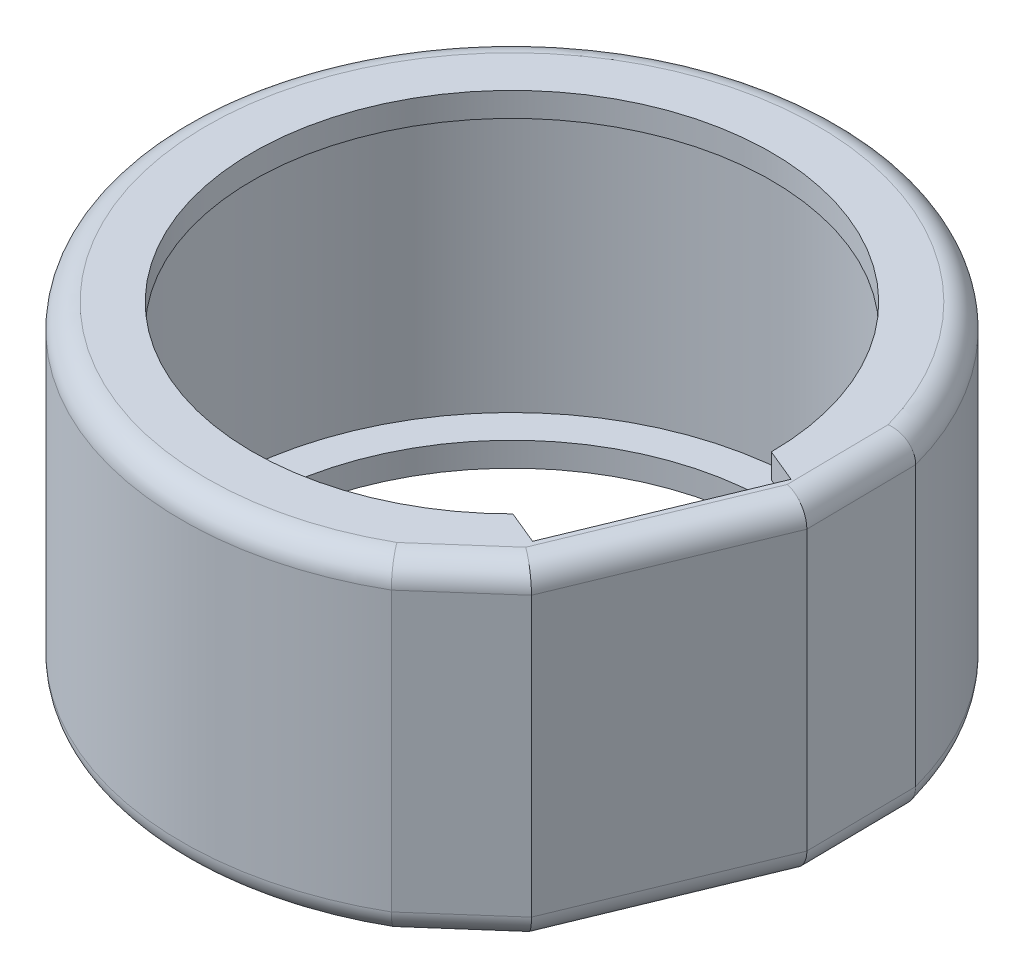
from build123d import *

# Parameters (mm, degrees)
EXTRUDE_1_DEPTH         = 1
EXTRUDE_START           = 11.5
EXTRUDE_3_DEPTH         = 11.5
EXTRUDE_START_2         = 1
EXTRUDE_4_DEPTH         = 1
FILLET_1_R              = 1
FILLET_2_R              = 1
SKETCH_7_W              = 8.165789474
SKETCH_7_H              = 1
CUT_EXTRUDE_1_DEPTH     = 1.5
CUT_EXTRUDE1_REACH      = 35.09
CUT_EXTRUDE1_END_RADIUS = 12.1
SKETCH5_R               = 0.8


with BuildPart() as part:
    # 草图1 → 凸台-拉伸1 (new body)
    with BuildSketch(Plane(origin=(0, 0, 0), x_dir=(1, 0, 0), z_dir=(0, 1, 0))):
        with BuildLine():
            Line((13.195707881, -1.030263158), (9.875971039, -9.071988551))
            Line((9.875971039, -9.071988551), (6.8, -11.777945491))
            ThreePointArc((6.8, -11.777945491), (-12.564761642, 5.20449468), (13.136591238, 3.519939013))
            Line((13.136591238, 3.519939013), (13.195707881, -1.030263158))
        make_face()
        with BuildLine():
            Line((10.7, 0), (7.584106648, -7.547935237))
            ThreePointArc((7.584106648, -7.547935237), (-9.890397897, 4.082894737), (10.7, 0))
        make_face(mode=Mode.SUBTRACT)
    extrude(amount=EXTRUDE_1_DEPTH)

    # 草图2 → 凸台-拉伸3 (add)
    with BuildSketch(Plane(origin=(0, 0, 0), x_dir=(-1, 0, 0), z_dir=(0, -1, 0)).offset(EXTRUDE_START)):
        with BuildLine():
            Line((-13.195707881, -1.030263158), (-13.136591238, 3.519939013))
            ThreePointArc((-13.136591238, 3.519939013), (12.564761642, 5.20449468), (-6.8, -11.777945491))
            Line((-6.8, -11.777945491), (-9.875971039, -9.071988551))
            Line((-9.875971039, -9.071988551), (-13.195707881, -1.030263158))
        make_face()
        with BuildLine():
            Line((-8.931421918, -8.163314433), (-12.087803996, -0.543134011))
            ThreePointArc((-12.087803996, -0.543134011), (11.178942343, 4.630469532), (-8.931421918, -8.163314433))
        make_face(mode=Mode.SUBTRACT)
    extrude(amount=-EXTRUDE_3_DEPTH)

    # 草图5 → 凸台-拉伸4 (add)
    with BuildSketch(Plane(origin=(0, -11.5, 0), x_dir=(-1, 0, 0), z_dir=(0, -1, 0)).offset(EXTRUDE_START_2)):
        with BuildLine():
            Line((-13.136591238, 3.519939013), (-13.195707881, -1.030263158))
            Line((-13.195707881, -1.030263158), (-9.875971039, -9.071988551))
            Line((-9.875971039, -9.071988551), (-6.8, -11.777945491))
            ThreePointArc((-6.8, -11.777945491), (12.564761642, 5.20449468), (-13.136591238, 3.519939013))
        make_face()
        with BuildLine():
            Line((-10.7, 0), (-7.584106648, -7.547935237))
            ThreePointArc((-7.584106648, -7.547935237), (9.890397897, 4.082894737), (-10.7, 0))
        make_face(mode=Mode.SUBTRACT)
    extrude(amount=-EXTRUDE_4_DEPTH)

    # 圆角1
    # the kernel refuses this fillet: 1 mm, written as the material it takes off along each edge
    with BuildSketch(Plane(origin=(11.753026447, -12.5, 7.42072752), x_dir=(-0.6605044125759215, 0, -0.750822163343449), z_dir=(-0.7508221633434491, 0, 0.6605044125759215))) as fillet_1_piece_1:
        with BuildLine():
            CenterArc((FILLET_1_R, -FILLET_1_R), FILLET_1_R, 90, 90)
            Line((0, -FILLET_1_R), (0, 0))
            Line((0, 0), (FILLET_1_R, 0))
        make_face()
    extrude(amount=9.096803729, mode=Mode.SUBTRACT)
    with BuildSketch(Plane(origin=(0, -12.5, 0), x_dir=(0.6504408329525787, 0, 0.7595569253373676), z_dir=(0.7595569253373676, 0, -0.6504408329525787))) as fillet_1_piece_2:
        with BuildLine():
            CenterArc((13.6 - FILLET_1_R, -FILLET_1_R), FILLET_1_R, 0, 90)
            Line((13.6 - FILLET_1_R, 0), (13.6, 0))
            Line((13.6, 0), (13.6, -FILLET_1_R))
        make_face()
    revolve(axis=Axis((0, -12.5, 0), (0, -1, 0)), revolution_arc=306.149694078, mode=Mode.SUBTRACT)
    with BuildSketch(Plane(origin=(13.10411375, -12.5, -6.019728047), x_dir=(0, 1, 0), z_dir=(0.012990995176433182, 0, 0.9999156134616191))) as fillet_1_piece_3:
        with BuildLine():
            CenterArc((FILLET_1_R, FILLET_1_R), FILLET_1_R, 180, 90)
            Line((0, FILLET_1_R), (0, 0))
            Line((0, 0), (FILLET_1_R, 0))
        make_face()
    extrude(amount=9.55058618, mode=Mode.SUBTRACT)
    with BuildSketch(Plane(origin=(14.149655249, -12.5, -1.280577472), x_dir=(0, 1, 0), z_dir=(-0.381578947368421, 0, 0.9243362520886044))) as fillet_1_piece_4:
        with BuildLine():
            CenterArc((FILLET_1_R, FILLET_1_R), FILLET_1_R, 180, 90)
            Line((0, FILLET_1_R), (0, 0))
            Line((0, 0), (FILLET_1_R, 0))
        make_face()
    extrude(amount=13.7, mode=Mode.SUBTRACT)

    # 圆角2
    # the kernel refuses this fillet: 1 mm, written as the material it takes off along each edge
    with BuildSketch(Plane(origin=(13.10411375, 1, -6.019728047), x_dir=(0, -1, 0), z_dir=(0.012990995176439143, 0, 0.999915613461619))) as fillet_2_piece_1:
        with BuildLine():
            CenterArc((FILLET_2_R, -FILLET_2_R), FILLET_2_R, 90, 90)
            Line((0, -FILLET_2_R), (0, 0))
            Line((0, 0), (FILLET_2_R, 0))
        make_face()
    extrude(amount=9.55058618, mode=Mode.SUBTRACT)
    with BuildSketch(Plane(origin=(0, 1, 0), x_dir=(0.6504408329525777, 0, 0.7595569253373686), z_dir=(0.7595569253373686, 0, -0.6504408329525777))) as fillet_2_piece_2:
        with BuildLine():
            CenterArc((13.6 - FILLET_2_R, FILLET_2_R), FILLET_2_R, 270, 90)
            Line((13.6 - FILLET_2_R, 0), (13.6, 0))
            Line((13.6, 0), (13.6, FILLET_2_R))
        make_face()
    revolve(axis=Axis((0, 1, 0), (0, -1, 0)), revolution_arc=306.149694078, mode=Mode.SUBTRACT)
    with BuildSketch(Plane(origin=(11.753026447, 1, 7.42072752), x_dir=(-0.6605044125759212, 0, -0.7508221633434494), z_dir=(-0.7508221633434494, 0, 0.6605044125759212))) as fillet_2_piece_3:
        with BuildLine():
            CenterArc((FILLET_2_R, FILLET_2_R), FILLET_2_R, 180, 90)
            Line((0, FILLET_2_R), (0, 0))
            Line((0, 0), (FILLET_2_R, 0))
        make_face()
    extrude(amount=9.096803729, mode=Mode.SUBTRACT)
    with BuildSketch(Plane(origin=(14.149655249, 1, -1.280577472), x_dir=(-0.9243362520886043, 0, -0.38157894736842096), z_dir=(-0.381578947368421, 0, 0.9243362520886044))) as fillet_2_piece_4:
        with BuildLine():
            CenterArc((FILLET_2_R, FILLET_2_R), FILLET_2_R, 180, 90)
            Line((0, FILLET_2_R), (0, 0))
            Line((0, 0), (FILLET_2_R, 0))
        make_face()
    extrude(amount=13.7, mode=Mode.SUBTRACT)

    # 草图7 → 切除-拉伸1 (cut)
    with BuildSketch(Plane(origin=(9.142053324, 0, 3.773967619), x_dir=(-0.3815789473684208, 0, 0.9243362520886044), z_dir=(-0.9243362520886044, 0, -0.3815789473684208))):
        with Locations((0, 0.5)):
            Rectangle(SKETCH_7_W, SKETCH_7_H)
    extrude(amount=-CUT_EXTRUDE_1_DEPTH, mode=Mode.SUBTRACT)

    # Cut-Extrude1: up to this cylinder (the profile starts outside it)
    cut_extrude1_end = Plane(origin=(0, -5.75, 0), z_dir=(0, 1, 0)) * Cylinder(CUT_EXTRUDE1_END_RADIUS, 95.38, mode=Mode.PRIVATE)
    # Sketch5 → Cut-Extrude1 (cut, up to the surface)
    with BuildSketch(Plane(origin=(-11.208116165, -5.75, 7.703124822), x_dir=(0.5664062369248345, 0, 0.8241261886220146), z_dir=(-0.8241261886220146, 0, 0.5664062369248345)), mode=Mode.PRIVATE) as cut_extrude1_sk1:
        Circle(SKETCH5_R)
    cut_extrude1_tool1 = extrude(cut_extrude1_sk1.sketch, amount=-CUT_EXTRUDE1_REACH, mode=Mode.PRIVATE) - cut_extrude1_end
    add(cut_extrude1_tool1.solids().sort_by_distance((-11.208116, -5.75, 7.703125))[0], mode=Mode.SUBTRACT)


solid = part.part
